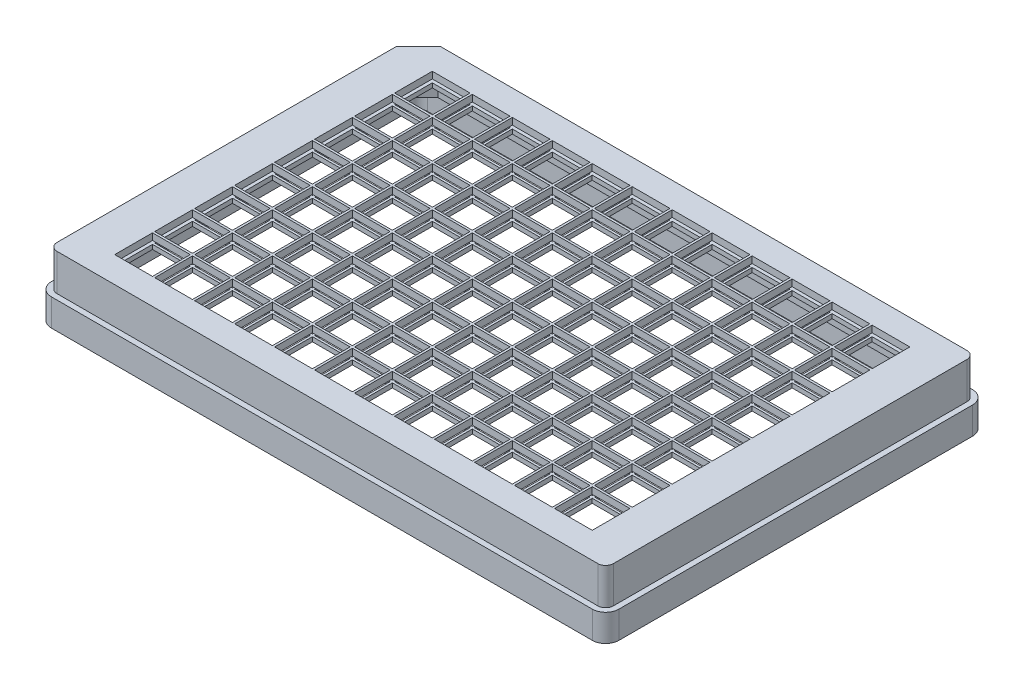
from build123d import *

# Parameters (mm, degrees)
SKETCH1_W           = 127.75
SKETCH1_H           = 85.6
BOSS_EXTRUDE1_DEPTH = 14.35
FILLET1_R           = 3
CUT_FLANGE_DEPTH    = 8.25
SKETCH5_W           = 80.1
SKETCH5_H           = 0.75
CUT_PAPERSLOT_DEPTH = 123.75
SHELL1_DEPTH        = 11.1
SHELL1_2_DEPTH      = 5.1
SKETCH4_W           = 8.5
SKETCH4_H           = 8.5
CUT_EXTRUDE3_DEPTH  = 20


# Read off the part's stored shape, not the designer's step: Shell1
with BuildPart() as part:
    # Sketch1 → Boss-Extrude1 (new body)
    with BuildSketch(Plane(origin=(0, 0, 0), x_dir=(1, 0, 0), z_dir=(0, 1, 0))):
        Rectangle(SKETCH1_W, SKETCH1_H)
    extrude(amount=BOSS_EXTRUDE1_DEPTH)

    # Fillet1
    fillet1_edges = [part.edges().sort_by_distance(p)[0] for p in [
        (-63.875, 7.175, -42.8),
        (63.875, 7.175, -42.8),
        (63.875, 7.175, 42.8),
        (-63.875, 7.175, 42.8),
    ]]
    fillet(fillet1_edges, radius=FILLET1_R)

    # Sketch3 → Cut-Flange (cut)
    with BuildSketch(Plane(origin=(0, 14.35, 0), x_dir=(1, 0, 0), z_dir=(0, 1, 0))):
        with BuildLine():
            Line((-63.875, 39.8), (-63.875, -39.8))
            ThreePointArc((-63.875, -39.8), (-62.996320344, -41.921320344), (-60.875, -42.8))
            Line((-60.875, -42.8), (60.875, -42.8))
            ThreePointArc((60.875, -42.8), (62.996320344, -41.921320344), (63.875, -39.8))
            Line((63.875, -39.8), (63.875, 39.8))
            ThreePointArc((63.875, 39.8), (62.996320344, 41.921320344), (60.875, 42.8))
            Line((60.875, 42.8), (-60.875, 42.8))
            ThreePointArc((-60.875, 42.8), (-62.996320344, 41.921320344), (-63.875, 39.8))
        make_face()
        with BuildLine():
            Line((-62.625, 36.600252532), (-62.625, -39.8))
            ThreePointArc((-62.625, -39.8), (-62.112436867, -41.037436867), (-60.875, -41.55))
            Line((-60.875, -41.55), (60.875, -41.55))
            ThreePointArc((60.875, -41.55), (62.112436867, -41.037436867), (62.625, -39.8))
            Line((62.625, -39.8), (62.625, 39.8))
            ThreePointArc((62.625, 39.8), (62.112436867, 41.037436867), (60.875, 41.55))
            Line((60.875, 41.55), (-57.675252532, 41.55))
            Line((-57.675252532, 41.55), (-62.625, 36.600252532))
        make_face(mode=Mode.SUBTRACT)
    extrude(amount=-CUT_FLANGE_DEPTH, mode=Mode.SUBTRACT)

    # Sketch5 → Cut-PaperSlot (cut)
    with BuildSketch(Plane.ZY.offset(62.625)):
        with Locations((0, 12.475)):
            Rectangle(SKETCH5_W, SKETCH5_H)
    extrude(amount=-CUT_PAPERSLOT_DEPTH, mode=Mode.SUBTRACT)

    # Shell1 outline → Shell1 (cut)
    with BuildSketch(Plane(origin=(0, 0, 0), x_dir=(1, 0, 0), z_dir=(0, 1, 0))):
        with BuildLine():
            Line((-61.625, 36.186038969), (-61.625, -39.8))
            ThreePointArc((-61.625, -39.8), (-61.405330086, -40.330330086), (-60.875, -40.55))
            Line((-60.875, -40.55), (60.875, -40.55))
            ThreePointArc((60.875, -40.55), (61.405330086, -40.330330086), (61.625, -39.8))
            Line((61.625, -39.8), (61.625, 39.8))
            ThreePointArc((61.625, 39.8), (61.405330086, 40.330330086), (60.875, 40.55))
            Line((60.875, 40.55), (-57.261038969, 40.55))
            Line((-57.261038969, 40.55), (-61.625, 36.186038969))
        make_face()
    extrude(amount=SHELL1_DEPTH, mode=Mode.SUBTRACT)

    # Shell1 2 outline → Shell1 2 (cut)
    with BuildSketch(Plane(origin=(0, 0, 0), x_dir=(1, 0, 0), z_dir=(0, 1, 0))):
        with BuildLine():
            Line((-62.875, 39.8), (-62.875, -39.8))
            ThreePointArc((-62.875, -39.8), (-62.289213562, -41.214213562), (-60.875, -41.8))
            Line((-60.875, -41.8), (60.875, -41.8))
            ThreePointArc((60.875, -41.8), (62.289213562, -41.214213562), (62.875, -39.8))
            Line((62.875, -39.8), (62.875, 39.8))
            ThreePointArc((62.875, 39.8), (62.289213562, 41.214213562), (60.875, 41.8))
            Line((60.875, 41.8), (-60.875, 41.8))
            ThreePointArc((-60.875, 41.8), (-62.289213562, 41.214213562), (-62.875, 39.8))
        make_face()
        with BuildLine():
            ThreePointArc((-60.875, -40.55), (-61.405330086, -40.330330086), (-61.625, -39.8))
            Line((-61.625, -39.8), (-61.625, 36.186038969))
            Line((-61.625, 36.186038969), (-57.261038969, 40.55))
            Line((-57.261038969, 40.55), (60.875, 40.55))
            ThreePointArc((60.875, 40.55), (61.405330086, 40.330330086), (61.625, 39.8))
            Line((61.625, 39.8), (61.625, -39.8))
            ThreePointArc((61.625, -39.8), (61.405330086, -40.330330086), (60.875, -40.55))
            Line((60.875, -40.55), (-60.875, -40.55))
        make_face(mode=Mode.SUBTRACT)
    extrude(amount=SHELL1_2_DEPTH, mode=Mode.SUBTRACT)

    # Sketch4 → Cut-Extrude3 (cut)
    with BuildSketch(Plane(origin=(0, 14.35, 0), x_dir=(1, 0, 0), z_dir=(0, 1, 0))):
        with Locations((-40.495, 31.56)):
            Rectangle(SKETCH4_W, SKETCH4_H)
        with Locations((-49.495, 31.56)):
            Rectangle(SKETCH4_W, SKETCH4_H)
        with Locations((-31.495, 31.56)):
            Rectangle(SKETCH4_W, SKETCH4_H)
        with Locations((-22.495, 31.56)):
            Rectangle(SKETCH4_W, SKETCH4_H)
        with Locations((-13.495, 31.56)):
            Rectangle(SKETCH4_W, SKETCH4_H)
        with Locations((-4.495, 31.56)):
            Rectangle(SKETCH4_W, SKETCH4_H)
        with Locations((4.505, 31.56)):
            Rectangle(SKETCH4_W, SKETCH4_H)
        with Locations((13.505, 31.56)):
            Rectangle(SKETCH4_W, SKETCH4_H)
        with Locations((22.505, 31.56)):
            Rectangle(SKETCH4_W, SKETCH4_H)
        with Locations((31.505, 31.56)):
            Rectangle(SKETCH4_W, SKETCH4_H)
        with Locations((40.505, 31.56)):
            Rectangle(SKETCH4_W, SKETCH4_H)
        with Locations((49.505, 31.56)):
            Rectangle(SKETCH4_W, SKETCH4_H)
        with Locations((-40.495, 22.56)):
            Rectangle(SKETCH4_W, SKETCH4_H)
        with Locations((-31.495, 22.56)):
            Rectangle(SKETCH4_W, SKETCH4_H)
        with Locations((-22.495, 22.56)):
            Rectangle(SKETCH4_W, SKETCH4_H)
        with Locations((-13.495, 22.56)):
            Rectangle(SKETCH4_W, SKETCH4_H)
        with Locations((-4.495, 22.56)):
            Rectangle(SKETCH4_W, SKETCH4_H)
        with Locations((4.505, 22.56)):
            Rectangle(SKETCH4_W, SKETCH4_H)
        with Locations((13.505, 22.56)):
            Rectangle(SKETCH4_W, SKETCH4_H)
        with Locations((22.505, 22.56)):
            Rectangle(SKETCH4_W, SKETCH4_H)
        with Locations((31.505, 22.56)):
            Rectangle(SKETCH4_W, SKETCH4_H)
        with Locations((40.505, 22.56)):
            Rectangle(SKETCH4_W, SKETCH4_H)
        with Locations((49.505, 22.56)):
            Rectangle(SKETCH4_W, SKETCH4_H)
        with Locations((-40.495, 13.56)):
            Rectangle(SKETCH4_W, SKETCH4_H)
        with Locations((-31.495, 13.56)):
            Rectangle(SKETCH4_W, SKETCH4_H)
        with Locations((-22.495, 13.56)):
            Rectangle(SKETCH4_W, SKETCH4_H)
        with Locations((-13.495, 13.56)):
            Rectangle(SKETCH4_W, SKETCH4_H)
        with Locations((-4.495, 13.56)):
            Rectangle(SKETCH4_W, SKETCH4_H)
        with Locations((4.505, 13.56)):
            Rectangle(SKETCH4_W, SKETCH4_H)
        with Locations((13.505, 13.56)):
            Rectangle(SKETCH4_W, SKETCH4_H)
        with Locations((22.505, 13.56)):
            Rectangle(SKETCH4_W, SKETCH4_H)
        with Locations((31.505, 13.56)):
            Rectangle(SKETCH4_W, SKETCH4_H)
        with Locations((40.505, 13.56)):
            Rectangle(SKETCH4_W, SKETCH4_H)
        with Locations((49.505, 13.56)):
            Rectangle(SKETCH4_W, SKETCH4_H)
        with Locations((-40.495, 4.56)):
            Rectangle(SKETCH4_W, SKETCH4_H)
        with Locations((-31.495, 4.56)):
            Rectangle(SKETCH4_W, SKETCH4_H)
        with Locations((-22.495, 4.56)):
            Rectangle(SKETCH4_W, SKETCH4_H)
        with Locations((-13.495, 4.56)):
            Rectangle(SKETCH4_W, SKETCH4_H)
        with Locations((-4.495, 4.56)):
            Rectangle(SKETCH4_W, SKETCH4_H)
        with Locations((4.505, 4.56)):
            Rectangle(SKETCH4_W, SKETCH4_H)
        with Locations((13.505, 4.56)):
            Rectangle(SKETCH4_W, SKETCH4_H)
        with Locations((22.505, 4.56)):
            Rectangle(SKETCH4_W, SKETCH4_H)
        with Locations((31.505, 4.56)):
            Rectangle(SKETCH4_W, SKETCH4_H)
        with Locations((40.505, 4.56)):
            Rectangle(SKETCH4_W, SKETCH4_H)
        with Locations((49.505, 4.56)):
            Rectangle(SKETCH4_W, SKETCH4_H)
        with Locations((-40.495, -4.44)):
            Rectangle(SKETCH4_W, SKETCH4_H)
        with Locations((-31.495, -4.44)):
            Rectangle(SKETCH4_W, SKETCH4_H)
        with Locations((-22.495, -4.44)):
            Rectangle(SKETCH4_W, SKETCH4_H)
        with Locations((-13.495, -4.44)):
            Rectangle(SKETCH4_W, SKETCH4_H)
        with Locations((-4.495, -4.44)):
            Rectangle(SKETCH4_W, SKETCH4_H)
        with Locations((4.505, -4.44)):
            Rectangle(SKETCH4_W, SKETCH4_H)
        with Locations((13.505, -4.44)):
            Rectangle(SKETCH4_W, SKETCH4_H)
        with Locations((22.505, -4.44)):
            Rectangle(SKETCH4_W, SKETCH4_H)
        with Locations((31.505, -4.44)):
            Rectangle(SKETCH4_W, SKETCH4_H)
        with Locations((40.505, -4.44)):
            Rectangle(SKETCH4_W, SKETCH4_H)
        with Locations((49.505, -4.44)):
            Rectangle(SKETCH4_W, SKETCH4_H)
        with Locations((-40.495, -13.44)):
            Rectangle(SKETCH4_W, SKETCH4_H)
        with Locations((-31.495, -13.44)):
            Rectangle(SKETCH4_W, SKETCH4_H)
        with Locations((-22.495, -13.44)):
            Rectangle(SKETCH4_W, SKETCH4_H)
        with Locations((-13.495, -13.44)):
            Rectangle(SKETCH4_W, SKETCH4_H)
        with Locations((-4.495, -13.44)):
            Rectangle(SKETCH4_W, SKETCH4_H)
        with Locations((4.505, -13.44)):
            Rectangle(SKETCH4_W, SKETCH4_H)
        with Locations((13.505, -13.44)):
            Rectangle(SKETCH4_W, SKETCH4_H)
        with Locations((22.505, -13.44)):
            Rectangle(SKETCH4_W, SKETCH4_H)
        with Locations((31.505, -13.44)):
            Rectangle(SKETCH4_W, SKETCH4_H)
        with Locations((40.505, -13.44)):
            Rectangle(SKETCH4_W, SKETCH4_H)
        with Locations((49.505, -13.44)):
            Rectangle(SKETCH4_W, SKETCH4_H)
        with Locations((-40.495, -22.44)):
            Rectangle(SKETCH4_W, SKETCH4_H)
        with Locations((-31.495, -22.44)):
            Rectangle(SKETCH4_W, SKETCH4_H)
        with Locations((-22.495, -22.44)):
            Rectangle(SKETCH4_W, SKETCH4_H)
        with Locations((-13.495, -22.44)):
            Rectangle(SKETCH4_W, SKETCH4_H)
        with Locations((-4.495, -22.44)):
            Rectangle(SKETCH4_W, SKETCH4_H)
        with Locations((4.505, -22.44)):
            Rectangle(SKETCH4_W, SKETCH4_H)
        with Locations((13.505, -22.44)):
            Rectangle(SKETCH4_W, SKETCH4_H)
        with Locations((22.505, -22.44)):
            Rectangle(SKETCH4_W, SKETCH4_H)
        with Locations((31.505, -22.44)):
            Rectangle(SKETCH4_W, SKETCH4_H)
        with Locations((40.505, -22.44)):
            Rectangle(SKETCH4_W, SKETCH4_H)
        with Locations((49.505, -22.44)):
            Rectangle(SKETCH4_W, SKETCH4_H)
        with Locations((-40.495, -31.44)):
            Rectangle(SKETCH4_W, SKETCH4_H)
        with Locations((-31.495, -31.44)):
            Rectangle(SKETCH4_W, SKETCH4_H)
        with Locations((-22.495, -31.44)):
            Rectangle(SKETCH4_W, SKETCH4_H)
        with Locations((-13.495, -31.44)):
            Rectangle(SKETCH4_W, SKETCH4_H)
        with Locations((-4.495, -31.44)):
            Rectangle(SKETCH4_W, SKETCH4_H)
        with Locations((4.505, -31.44)):
            Rectangle(SKETCH4_W, SKETCH4_H)
        with Locations((13.505, -31.44)):
            Rectangle(SKETCH4_W, SKETCH4_H)
        with Locations((22.505, -31.44)):
            Rectangle(SKETCH4_W, SKETCH4_H)
        with Locations((31.505, -31.44)):
            Rectangle(SKETCH4_W, SKETCH4_H)
        with Locations((40.505, -31.44)):
            Rectangle(SKETCH4_W, SKETCH4_H)
        with Locations((49.505, -31.44)):
            Rectangle(SKETCH4_W, SKETCH4_H)
        with Locations((-49.495, 22.56)):
            Rectangle(SKETCH4_W, SKETCH4_H)
        with Locations((-49.495, 13.56)):
            Rectangle(SKETCH4_W, SKETCH4_H)
        with Locations((-49.495, 4.56)):
            Rectangle(SKETCH4_W, SKETCH4_H)
        with Locations((-49.495, -4.44)):
            Rectangle(SKETCH4_W, SKETCH4_H)
        with Locations((-49.495, -13.44)):
            Rectangle(SKETCH4_W, SKETCH4_H)
        with Locations((-49.495, -22.44)):
            Rectangle(SKETCH4_W, SKETCH4_H)
        with Locations((-49.495, -31.44)):
            Rectangle(SKETCH4_W, SKETCH4_H)
    extrude(amount=-CUT_EXTRUDE3_DEPTH, mode=Mode.SUBTRACT)


solid = part.part
